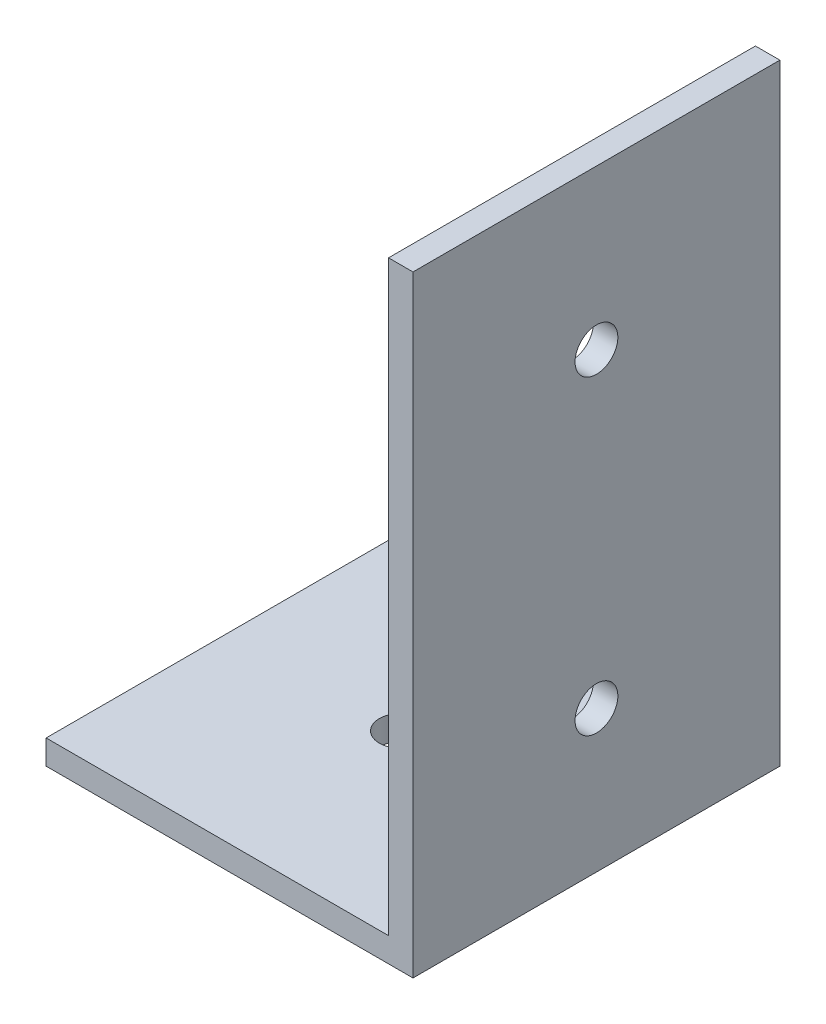
from build123d import *

# Parameters (mm, degrees)
ESTRUSIONE_ESTRUSIONE1_DEPTH = 30
SCHIZZO2_R                   = 1.75
TAGLIO_ESTRUSIONE1_DEPTH     = 65.683846515
SCHIZZO3_R                   = 1.75
TAGLIO_ESTRUSIONE2_DEPTH     = 65.062469512


with BuildPart() as part:
    # Schizzo1 → Estrusione-Estrusione1 (new body)
    with BuildSketch(Plane.XY):
        Polygon((0, 0), (-30, 0), (-30, 2), (-2, 2), (-2, 50), (0, 50), align=None)
    extrude(amount=ESTRUSIONE_ESTRUSIONE1_DEPTH)

    # Schizzo2 → Taglio-Estrusione1 (cut, through all)
    with BuildSketch(Plane.ZY.offset(2)):
        with Locations((15, 37)):
            Circle(SCHIZZO2_R)
        with Locations((15, 11.6)):
            Circle(SCHIZZO2_R)
    extrude(amount=-TAGLIO_ESTRUSIONE1_DEPTH, mode=Mode.SUBTRACT)

    # Schizzo3 → Taglio-Estrusione2 (cut, through all)
    with BuildSketch(Plane(origin=(0, 2, 0), x_dir=(1, 0, 0), z_dir=(0, 1, 0))):
        with Locations((-16, -15)):
            Circle(SCHIZZO3_R)
    extrude(amount=-TAGLIO_ESTRUSIONE2_DEPTH, mode=Mode.SUBTRACT)


solid = part.part
